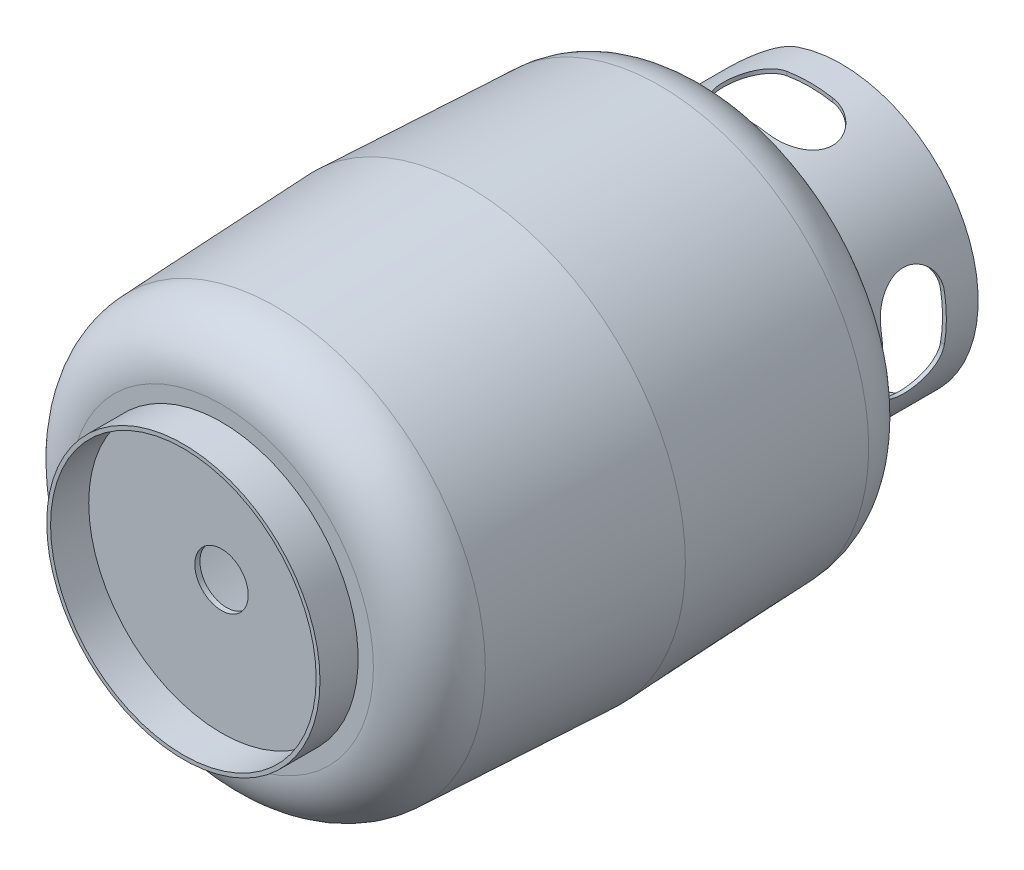
from build123d import *

# Parameters (mm, degrees)
SKETCH3_R           = 21
CUT_EXTRUDE1_DEPTH  = 474.825305119
BOSS_EXTRUDE1_DEPTH = 100
CUT_EXTRUDE2_DEPTH  = 545.160288675
CIRPATTERN1_COUNT   = 3
CIRPATTERN1_ANGLE   = 180
FILLET1_R           = 30
BOSS_EXTRUDE2_START = 30
SKETCH6_R           = 107.421871599
SKETCH6_R_2         = 104.421871599
BOSS_EXTRUDE2_DEPTH = 30


with BuildPart() as part:
    # Sketch2 → Revolve1 (revolve)
    with BuildSketch(Plane(origin=(0, 0, 0), x_dir=(1, 0, 0), z_dir=(0, 1, 0)), mode=Mode.PRIVATE) as revolve1_sk:
        with BuildLine():
            Line((0, 0), (-119.421871599, 0))
            ThreePointArc((-119.421871599, 0), (-150.539959109, 12.493621707), (-164.37904157, 43.037127569))
            Line((-164.37904157, 43.037127569), (-170.959307689, 193.75))
            Line((-170.959307689, 193.75), (-164.37904157, 344.462872431))
            ThreePointArc((-164.37904157, 344.462872431), (-150.539959109, 375.006378293), (-119.421871599, 387.5))
            Line((-119.421871599, 387.5), (-37, 387.5))
            ThreePointArc((-37, 387.5), (-28.514718626, 391.014718626), (-25, 399.5))
            Line((-25, 399.5), (-25, 407.5))
            Line((-25, 407.5), (0, 407.5))
            Line((0, 407.5), (0, 403.5))
            Line((0, 403.5), (-21, 403.5))
            Line((-21, 403.5), (-21, 399.5))
            ThreePointArc((-21, 399.5), (-25.686291501, 388.186291501), (-37, 383.5))
            Line((-37, 383.5), (-119.421871599, 383.5))
            ThreePointArc((-119.421871599, 383.5), (-147.773906886, 372.116922444), (-160.382848683, 344.288394882))
            Line((-160.382848683, 344.288394882), (-166.955496948, 193.75))
            Line((-166.955496948, 193.75), (-160.382848683, 43.211605118))
            ThreePointArc((-160.382848683, 43.211605118), (-147.773906886, 15.383077556), (-119.421871599, 4))
            Line((-119.421871599, 4), (0, 4))
            Line((0, 4), (0, 0))
        make_face()
    revolve(revolve1_sk.sketch.rotate(Axis((0, 0, 0), (0, 0, -1)), 180), axis=Axis((0, 0, 0), (0, 0, -1)))

    # Sketch3 → Cut-Extrude1 (cut, through all)
    with BuildSketch(Plane(origin=(0, 0, -407.5), x_dir=(-1, 0, 0), z_dir=(0, 0, -1))):
        Circle(SKETCH3_R)
    extrude(amount=-CUT_EXTRUDE1_DEPTH, mode=Mode.SUBTRACT)

    # Sketch4 → Boss-Extrude1 (add)
    with BuildSketch(Plane(origin=(0, 0, -387.5), x_dir=(-1, 0, 0), z_dir=(0, 0, -1))):
        with BuildLine():
            ThreePointArc((59.893924989, -85.537389588), (-104.421871599, 0), (59.893924989, 85.537389588))
            Line((59.893924989, 85.537389588), (61.614654298, 87.994845721))
            ThreePointArc((61.614654298, 87.994845721), (-107.421871599, 0), (61.614654298, -87.994845721))
            Line((61.614654298, -87.994845721), (59.893924989, -85.537389588))
        make_face()
    extrude(amount=BOSS_EXTRUDE1_DEPTH)

    # Sketch5 → Cut-Extrude2 (cut, through all)
    with BuildSketch(Plane(origin=(0, 0, 0), x_dir=(1, 0, 0), z_dir=(0, 1, 0))):
        with BuildLine():
            Line((-18, 462.5), (18, 462.5))
            ThreePointArc((18, 462.5), (43, 437.5), (18, 412.5))
            Line((18, 412.5), (-18, 412.5))
            ThreePointArc((-18, 412.5), (-43, 437.5), (-18, 462.5))
        make_face()
    cut_extrude2 = extrude(amount=-CUT_EXTRUDE2_DEPTH, mode=Mode.SUBTRACT)

    # CirPattern1: Cut-Extrude2 ×3 about axis
    cirpattern1_axis = Axis((0, 0, -487.5), (0, 0, 1))
    for i in range(1, CIRPATTERN1_COUNT):
        add(cut_extrude2.rotate(cirpattern1_axis, i * CIRPATTERN1_ANGLE / (CIRPATTERN1_COUNT - 1)), mode=Mode.SUBTRACT)

    # Fillet1
    # the kernel refuses this fillet: 30 mm, written as the material it takes off along each edge
    with BuildSketch(Plane(origin=(-104.632887024, -149.431249043, -487.5), x_dir=(0, 0, 1), z_dir=(0.5735764363510444, 0.8191520442889931, 0))) as fillet1_piece_1_section:
        with BuildLine():
            CenterArc((FILLET1_R, FILLET1_R), FILLET1_R, 180, 90)
            Line((0, FILLET1_R), (-FILLET1_R * 0.02, FILLET1_R))
            Line((-FILLET1_R * 0.02, FILLET1_R), (-FILLET1_R * 0.02, -FILLET1_R * 0.02))
            Line((-FILLET1_R * 0.02, -FILLET1_R * 0.02), (FILLET1_R, -FILLET1_R * 0.02))
            Line((FILLET1_R, -FILLET1_R * 0.02), (FILLET1_R, 0))
        make_face()
    fillet1_piece_1 = extrude(amount=153, mode=Mode.PRIVATE)
    fillet1_piece_1 = fillet1_piece_1 - Plane(origin=(0, 0, -480.728071608), x_dir=(-0.5735764363510439, -0.8191520442889934, 0), z_dir=(0, 0, 1)) * Cylinder(104.421871599, 427, mode=Mode.PRIVATE)
    fillet1_piece_1 = fillet1_piece_1 & Plane(origin=(0, 0, -480.728071608), x_dir=(-0.573576436351044, 0.8191520442889932, 0), z_dir=(0, 0, 1)) * Cylinder(107.421871599, 427, mode=Mode.PRIVATE)
    add(fillet1_piece_1, mode=Mode.SUBTRACT)
    with BuildSketch(Plane(origin=(-16.875692262, 24.100986267, -487.5), x_dir=(0, 0, 1), z_dir=(-0.573576436351045, 0.8191520442889927, 0))) as fillet1_piece_2_section:
        with BuildLine():
            CenterArc((FILLET1_R, FILLET1_R), FILLET1_R, 180, 90)
            Line((0, FILLET1_R), (-FILLET1_R * 0.02, FILLET1_R))
            Line((-FILLET1_R * 0.02, FILLET1_R), (-FILLET1_R * 0.02, -FILLET1_R * 0.02))
            Line((-FILLET1_R * 0.02, -FILLET1_R * 0.02), (FILLET1_R, -FILLET1_R * 0.02))
            Line((FILLET1_R, -FILLET1_R * 0.02), (FILLET1_R, 0))
        make_face()
    fillet1_piece_2 = extrude(amount=153, mode=Mode.PRIVATE)
    fillet1_piece_2 = fillet1_piece_2 - Plane(origin=(0, 0, -480.728050217), x_dir=(-0.5735764363510439, -0.8191520442889934, 0), z_dir=(0, 0, 1)) * Cylinder(104.421871599, 426, mode=Mode.PRIVATE)
    fillet1_piece_2 = fillet1_piece_2 & Plane(origin=(0, 0, -480.728050217), x_dir=(-0.573576436351044, 0.8191520442889932, 0), z_dir=(0, 0, 1)) * Cylinder(107.421871599, 426, mode=Mode.PRIVATE)
    add(fillet1_piece_2, mode=Mode.SUBTRACT)

    # Sketch6 → Boss-Extrude2 (add)
    with BuildSketch(Plane.XY.offset(BOSS_EXTRUDE2_START)):
        with Locations(Location((0, 0, 0), (0, 0, 180))):
            Circle(SKETCH6_R)
        Circle(SKETCH6_R_2, mode=Mode.SUBTRACT)
    extrude(amount=-BOSS_EXTRUDE2_DEPTH)


solid = part.part
